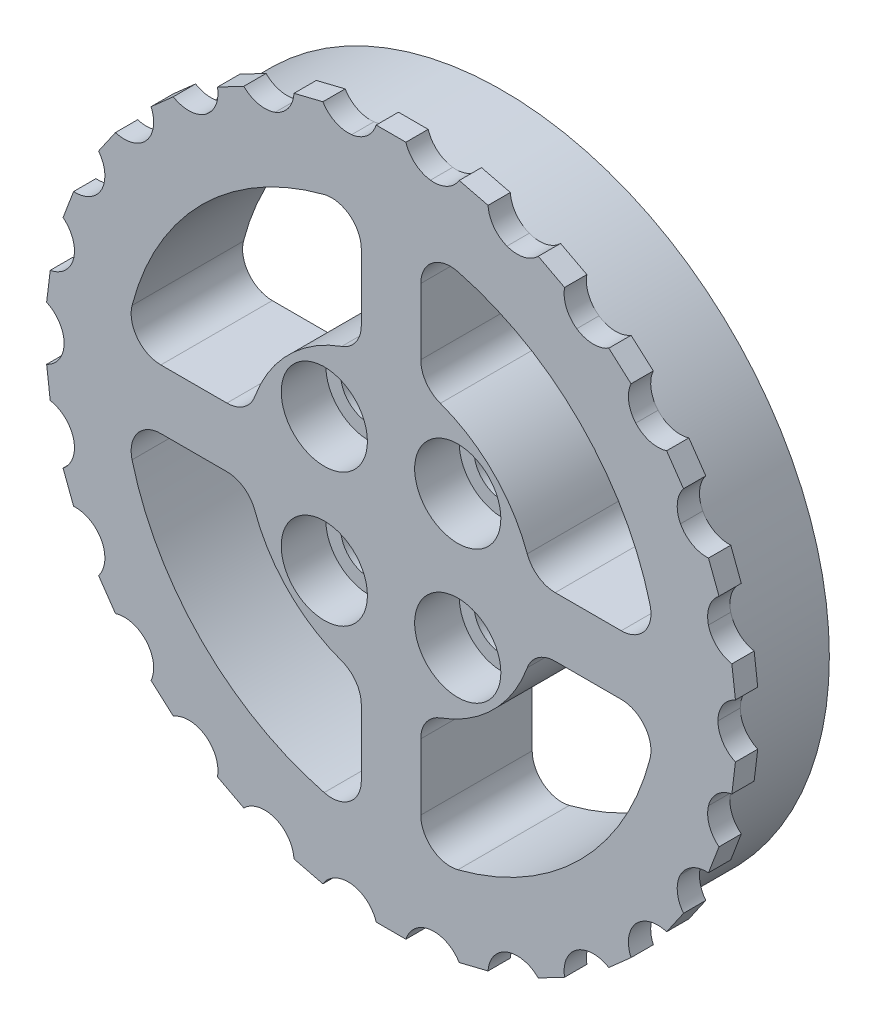
from build123d import *

# Parameters (mm, degrees)
SKETCH1_R           = 22
BOSS_EXTRUDE1_DEPTH = 6
BOSS_EXTRUDE2_DEPTH = 1.5
SKETCH3_R           = 1.375
BOSS_EXTRUDE3_DEPTH = 2.5
CUT_EXTRUDE3_REACH  = 36.304
SKETCH6_R           = 1.9
SKETCH7_R           = 2.9
CUT_EXTRUDE4_DEPTH  = 3


with BuildPart() as part:
    # Sketch1 → Boss-Extrude1 (new body)
    with BuildSketch(Plane.XY):
        Circle(SKETCH1_R)
        with BuildLine():
            Line((11.048189897, 2), (15.491933385, 2))
            ThreePointArc((15.491933385, 2), (17.073072215, 2.775255129), (17.428425058, 4.5))
            ThreePointArc((17.428425058, 4.5), (12.727922061, 12.727922061), (4.5, 17.428425058))
            ThreePointArc((4.5, 17.428425058), (2.775255129, 17.073072215), (2, 15.491933385))
            Line((2, 15.491933385), (2, 11.048189897))
            ThreePointArc((2, 11.048189897), (2.362669531, 9.899647805), (3.319148936, 9.167646936))
            ThreePointArc((3.319148936, 9.167646936), (6.894291117, 6.894291117), (9.167646936, 3.319148936))
            ThreePointArc((9.167646936, 3.319148936), (9.899647805, 2.362669531), (11.048189897, 2))
        make_face(mode=Mode.SUBTRACT)
        with BuildLine():
            Line((-15.491933385, 2), (-11.048189897, 2))
            ThreePointArc((-11.048189897, 2), (-9.899647805, 2.362669531), (-9.167646936, 3.319148936))
            ThreePointArc((-9.167646936, 3.319148936), (-6.894291117, 6.894291117), (-3.319148936, 9.167646936))
            ThreePointArc((-3.319148936, 9.167646936), (-2.362669531, 9.899647805), (-2, 11.048189897))
            Line((-2, 11.048189897), (-2, 15.491933385))
            ThreePointArc((-2, 15.491933385), (-2.775255129, 17.073072215), (-4.5, 17.428425058))
            ThreePointArc((-4.5, 17.428425058), (-12.727922061, 12.727922061), (-17.428425058, 4.5))
            ThreePointArc((-17.428425058, 4.5), (-17.073072215, 2.775255129), (-15.491933385, 2))
        make_face(mode=Mode.SUBTRACT)
        with BuildLine():
            Line((2, -11.048189897), (2, -15.491933385))
            ThreePointArc((2, -15.491933385), (2.775255129, -17.073072215), (4.5, -17.428425058))
            ThreePointArc((4.5, -17.428425058), (12.727922061, -12.727922061), (17.428425058, -4.5))
            ThreePointArc((17.428425058, -4.5), (17.073072215, -2.775255129), (15.491933385, -2))
            Line((15.491933385, -2), (11.048189897, -2))
            ThreePointArc((11.048189897, -2), (9.899647805, -2.362669531), (9.167646936, -3.319148936))
            ThreePointArc((9.167646936, -3.319148936), (6.894291117, -6.894291117), (3.319148936, -9.167646936))
            ThreePointArc((3.319148936, -9.167646936), (2.362669531, -9.899647805), (2, -11.048189897))
        make_face(mode=Mode.SUBTRACT)
        with BuildLine():
            Line((-15.491933385, -2), (-11.048189897, -2))
            ThreePointArc((-11.048189897, -2), (-9.899647805, -2.362669531), (-9.167646936, -3.319148936))
            ThreePointArc((-9.167646936, -3.319148936), (-6.894291117, -6.894291117), (-3.319148936, -9.167646936))
            ThreePointArc((-3.319148936, -9.167646936), (-2.362669531, -9.899647805), (-2, -11.048189897))
            Line((-2, -11.048189897), (-2, -15.491933385))
            ThreePointArc((-2, -15.491933385), (-2.775255129, -17.073072215), (-4.5, -17.428425058))
            ThreePointArc((-4.5, -17.428425058), (-12.727922061, -12.727922061), (-17.428425058, -4.5))
            ThreePointArc((-17.428425058, -4.5), (-17.073072215, -2.775255129), (-15.491933385, -2))
        make_face(mode=Mode.SUBTRACT)
    extrude(amount=BOSS_EXTRUDE1_DEPTH)

    # Sketch2 → Boss-Extrude2 (add)
    with BuildSketch(Plane.XY.offset(6)):
        with BuildLine():
            Line((-4.587705573, 22.79163465), (-6.529589207, 22.313003321))
            ThreePointArc((-6.529589207, 22.313003321), (-6.910364179, 21.255540917), (-7.801329494, 20.570415293))
            ThreePointArc((-7.801329494, 20.570415293), (-8.922548934, 20.492419898), (-9.908790373, 21.031441363))
            Line((-9.908790373, 21.031441363), (-11.679702424, 20.101995018))
            ThreePointArc((-11.679702424, 20.101995018), (-11.796345449, 18.984135135), (-12.497459637, 18.105696059))
            ThreePointArc((-12.497459637, 18.105696059), (-13.567432959, 17.761641694), (-14.654012294, 18.048977149))
            Line((-14.654012294, 18.048977149), (-16.15103379, 16.722731833))
            ThreePointArc((-16.15103379, 16.722731833), (-15.996766, 15.609440423), (-16.467282853, 14.588739582))
            ThreePointArc((-16.467282853, 14.588739582), (-17.423827096, 13.998621436), (-18.547596285, 14.017571989))
            Line((-18.547596285, 14.017571989), (-19.683725779, 12.371604258))
            ThreePointArc((-19.683725779, 12.371604258), (-19.267512657, 11.327581771), (-19.480087446, 10.223938589))
            ThreePointArc((-19.480087446, 10.223938589), (-20.267611735, 9.422052183), (-21.363261398, 9.171516497))
            Line((-21.363261398, 9.171516497), (-22.072471173, 7.301484012))
            ThreePointArc((-22.072471173, 7.301484012), (-21.418501513, 6.387405241), (-21.360780164, 5.264959447))
            ThreePointArc((-21.360780164, 5.264959447), (-21.93351645, 4.297907504), (-22.937371411, 3.792445804))
            Line((-22.937371411, 3.792445804), (-23.178444772, 1.807028055))
            ThreePointArc((-23.178444772, 1.807028055), (-22.324724914, 1.076015936), (-22.000061981, 0))
            ThreePointArc((-22.000061981, 0), (-22.324724914, -1.076015936), (-23.178444772, -1.807028055))
            Line((-23.178444772, -1.807028055), (-22.937371411, -3.792445804))
            ThreePointArc((-22.937371411, -3.792445804), (-21.93351645, -4.297907504), (-21.360780164, -5.264959447))
            ThreePointArc((-21.360780164, -5.264959447), (-21.418501513, -6.387405241), (-22.072471173, -7.301484012))
            Line((-22.072471173, -7.301484012), (-21.363261398, -9.171516497))
            ThreePointArc((-21.363261398, -9.171516497), (-20.267611735, -9.422052183), (-19.480087446, -10.223938589))
            ThreePointArc((-19.480087446, -10.223938589), (-19.267512657, -11.327581771), (-19.683725779, -12.371604258))
            Line((-19.683725779, -12.371604258), (-18.547596285, -14.017571989))
            ThreePointArc((-18.547596285, -14.017571989), (-17.423827096, -13.998621436), (-16.467282853, -14.588739582))
            ThreePointArc((-16.467282853, -14.588739582), (-15.996766, -15.609440423), (-16.15103379, -16.722731833))
            Line((-16.15103379, -16.722731833), (-14.654012294, -18.048977149))
            ThreePointArc((-14.654012294, -18.048977149), (-13.567432959, -17.761641694), (-12.497459637, -18.105696059))
            ThreePointArc((-12.497459637, -18.105696059), (-11.796345449, -18.984135135), (-11.679702424, -20.101995018))
            Line((-11.679702424, -20.101995018), (-9.908790373, -21.031441363))
            ThreePointArc((-9.908790373, -21.031441363), (-8.922548934, -20.492419898), (-7.801329494, -20.570415293))
            ThreePointArc((-7.801329494, -20.570415293), (-6.910364179, -21.255540917), (-6.529589207, -22.313003321))
            Line((-6.529589207, -22.313003321), (-4.587705573, -22.79163465))
            ThreePointArc((-4.587705573, -22.79163465), (-3.759118797, -22.032253145), (-2.651814437, -21.839656759))
            ThreePointArc((-2.651814437, -21.839656759), (-1.62277766, -22.291651923), (-1, -23.227260976))
            Line((-1, -23.227260976), (1, -23.227260976))
            ThreePointArc((1, -23.227260976), (1.62277766, -22.291651923), (2.651814437, -21.839656759))
            ThreePointArc((2.651814437, -21.839656759), (3.759118797, -22.032253145), (4.587705573, -22.79163465))
            Line((4.587705573, -22.79163465), (6.529589207, -22.313003321))
            ThreePointArc((6.529589207, -22.313003321), (6.910364179, -21.255540917), (7.801329494, -20.570415293))
            ThreePointArc((7.801329494, -20.570415293), (8.922548934, -20.492419898), (9.908790373, -21.031441363))
            Line((9.908790373, -21.031441363), (11.679702424, -20.101995018))
            ThreePointArc((11.679702424, -20.101995018), (11.796345449, -18.984135135), (12.497459637, -18.105696059))
            ThreePointArc((12.497459637, -18.105696059), (13.567432959, -17.761641694), (14.654012294, -18.048977149))
            Line((14.654012294, -18.048977149), (16.15103379, -16.722731833))
            ThreePointArc((16.15103379, -16.722731833), (15.996766, -15.609440423), (16.467282853, -14.588739582))
            ThreePointArc((16.467282853, -14.588739582), (17.423827096, -13.998621436), (18.547596285, -14.017571989))
            Line((18.547596285, -14.017571989), (19.683725779, -12.371604258))
            ThreePointArc((19.683725779, -12.371604258), (19.267512657, -11.327581771), (19.480087446, -10.223938589))
            ThreePointArc((19.480087446, -10.223938589), (20.267611735, -9.422052183), (21.363261398, -9.171516497))
            Line((21.363261398, -9.171516497), (22.072471173, -7.301484012))
            ThreePointArc((22.072471173, -7.301484012), (21.418501513, -6.387405241), (21.360780164, -5.264959447))
            ThreePointArc((21.360780164, -5.264959447), (21.93351645, -4.297907504), (22.937371411, -3.792445804))
            Line((22.937371411, -3.792445804), (23.178444772, -1.807028055))
            ThreePointArc((23.178444772, -1.807028055), (22.324724914, -1.076015936), (22.000061981, 0))
            ThreePointArc((22.000061981, 0), (22.324724914, 1.076015936), (23.178444772, 1.807028055))
            Line((23.178444772, 1.807028055), (22.937371411, 3.792445804))
            ThreePointArc((22.937371411, 3.792445804), (21.93351645, 4.297907504), (21.360780164, 5.264959447))
            ThreePointArc((21.360780164, 5.264959447), (21.418501513, 6.387405241), (22.072471173, 7.301484012))
            Line((22.072471173, 7.301484012), (21.363261398, 9.171516497))
            ThreePointArc((21.363261398, 9.171516497), (20.267611735, 9.422052183), (19.480087446, 10.223938589))
            ThreePointArc((19.480087446, 10.223938589), (19.267512657, 11.327581771), (19.683725779, 12.371604258))
            Line((19.683725779, 12.371604258), (18.547596285, 14.017571989))
            ThreePointArc((18.547596285, 14.017571989), (17.423827096, 13.998621436), (16.467282853, 14.588739582))
            ThreePointArc((16.467282853, 14.588739582), (15.996766, 15.609440423), (16.15103379, 16.722731833))
            Line((16.15103379, 16.722731833), (14.654012294, 18.048977149))
            ThreePointArc((14.654012294, 18.048977149), (13.567432959, 17.761641694), (12.497459637, 18.105696059))
            ThreePointArc((12.497459637, 18.105696059), (11.796345449, 18.984135135), (11.679702424, 20.101995018))
            Line((11.679702424, 20.101995018), (9.908790373, 21.031441363))
            ThreePointArc((9.908790373, 21.031441363), (8.922548934, 20.492419898), (7.801329494, 20.570415293))
            ThreePointArc((7.801329494, 20.570415293), (6.910364179, 21.255540917), (6.529589207, 22.313003321))
            Line((6.529589207, 22.313003321), (4.587705573, 22.79163465))
            ThreePointArc((4.587705573, 22.79163465), (3.759118797, 22.032253145), (2.651814437, 21.839656759))
            ThreePointArc((2.651814437, 21.839656759), (1.62277766, 22.291651923), (1, 23.227260976))
            Line((1, 23.227260976), (-1, 23.227260976))
            ThreePointArc((-1, 23.227260976), (-1.62277766, 22.291651923), (-2.651814437, 21.839656759))
            ThreePointArc((-2.651814437, 21.839656759), (-3.759118797, 22.032253145), (-4.587705573, 22.79163465))
        make_face()
        with BuildLine():
            Line((-2, 11.048189897), (-2, 15.491933385))
            ThreePointArc((-2, 15.491933385), (-2.775255129, 17.073072215), (-4.5, 17.428425058))
            ThreePointArc((-4.5, 17.428425058), (-12.727922061, 12.727922061), (-17.428425058, 4.5))
            ThreePointArc((-17.428425058, 4.5), (-17.073072215, 2.775255129), (-15.491933385, 2))
            Line((-15.491933385, 2), (-11.048189897, 2))
            ThreePointArc((-11.048189897, 2), (-9.899647805, 2.362669531), (-9.167646936, 3.319148936))
            ThreePointArc((-9.167646936, 3.319148936), (-6.894291117, 6.894291117), (-3.319148936, 9.167646936))
            ThreePointArc((-3.319148936, 9.167646936), (-2.362669531, 9.899647805), (-2, 11.048189897))
        make_face(mode=Mode.SUBTRACT)
        with BuildLine():
            Line((2, 15.491933385), (2, 11.048189897))
            ThreePointArc((2, 11.048189897), (2.362669531, 9.899647805), (3.319148936, 9.167646936))
            ThreePointArc((3.319148936, 9.167646936), (6.894291117, 6.894291117), (9.167646936, 3.319148936))
            ThreePointArc((9.167646936, 3.319148936), (9.899647805, 2.362669531), (11.048189897, 2))
            Line((11.048189897, 2), (15.491933385, 2))
            ThreePointArc((15.491933385, 2), (17.073072215, 2.775255129), (17.428425058, 4.5))
            ThreePointArc((17.428425058, 4.5), (12.727922061, 12.727922061), (4.5, 17.428425058))
            ThreePointArc((4.5, 17.428425058), (2.775255129, 17.073072215), (2, 15.491933385))
        make_face(mode=Mode.SUBTRACT)
        with BuildLine():
            Line((2, -11.048189897), (2, -15.491933385))
            ThreePointArc((2, -15.491933385), (2.775255129, -17.073072215), (4.5, -17.428425058))
            ThreePointArc((4.5, -17.428425058), (12.727922061, -12.727922061), (17.428425058, -4.5))
            ThreePointArc((17.428425058, -4.5), (17.073072215, -2.775255129), (15.491933385, -2))
            Line((15.491933385, -2), (11.048189897, -2))
            ThreePointArc((11.048189897, -2), (9.899647805, -2.362669531), (9.167646936, -3.319148936))
            ThreePointArc((9.167646936, -3.319148936), (6.894291117, -6.894291117), (3.319148936, -9.167646936))
            ThreePointArc((3.319148936, -9.167646936), (2.362669531, -9.899647805), (2, -11.048189897))
        make_face(mode=Mode.SUBTRACT)
        with BuildLine():
            Line((-11.048189897, -2), (-15.491933385, -2))
            ThreePointArc((-15.491933385, -2), (-17.073072215, -2.775255129), (-17.428425058, -4.5))
            ThreePointArc((-17.428425058, -4.5), (-12.727922061, -12.727922061), (-4.5, -17.428425058))
            ThreePointArc((-4.5, -17.428425058), (-2.775255129, -17.073072215), (-2, -15.491933385))
            Line((-2, -15.491933385), (-2, -11.048189897))
            ThreePointArc((-2, -11.048189897), (-2.362669531, -9.899647805), (-3.319148936, -9.167646936))
            ThreePointArc((-3.319148936, -9.167646936), (-6.894291117, -6.894291117), (-9.167646936, -3.319148936))
            ThreePointArc((-9.167646936, -3.319148936), (-9.899647805, -2.362669531), (-11.048189897, -2))
        make_face(mode=Mode.SUBTRACT)
    extrude(amount=BOSS_EXTRUDE2_DEPTH)

    # Sketch3 → Boss-Extrude3 (add)
    with BuildSketch(Plane(origin=(0, 0, 0), x_dir=(-1, 0, 0), z_dir=(0, 0, -1))):
        with Locations((8, 0)):
            Circle(SKETCH3_R)
        with Locations((0, -8)):
            Circle(SKETCH3_R)
        with Locations((0, 8)):
            Circle(SKETCH3_R)
        with Locations((-8, 0)):
            Circle(SKETCH3_R)
    extrude(amount=BOSS_EXTRUDE3_DEPTH)

    # Sketch6 → Cut-Extrude3 (cut, up to next)
    with BuildSketch(Plane.XY.offset(7.5), mode=Mode.PRIVATE) as cut_extrude3_sk1:
        with Locations((4.490128061, 4.490128061)):
            Circle(SKETCH6_R)
    cut_extrude3_tool1 = extrude(cut_extrude3_sk1.sketch, amount=-CUT_EXTRUDE3_REACH, mode=Mode.PRIVATE) & part.part
    # Sketch6 → Cut-Extrude3 (cut, up to next)
    with BuildSketch(Plane.XY.offset(7.5), mode=Mode.PRIVATE) as cut_extrude3_sk2:
        with Locations((4.490128061, -4.490128061)):
            Circle(SKETCH6_R)
    cut_extrude3_tool2 = extrude(cut_extrude3_sk2.sketch, amount=-CUT_EXTRUDE3_REACH, mode=Mode.PRIVATE) & part.part
    # Sketch6 → Cut-Extrude3 (cut, up to next)
    with BuildSketch(Plane.XY.offset(7.5), mode=Mode.PRIVATE) as cut_extrude3_sk3:
        with Locations((-4.490128061, 4.490128061)):
            Circle(SKETCH6_R)
    cut_extrude3_tool3 = extrude(cut_extrude3_sk3.sketch, amount=-CUT_EXTRUDE3_REACH, mode=Mode.PRIVATE) & part.part
    # Sketch6 → Cut-Extrude3 (cut, up to next)
    with BuildSketch(Plane.XY.offset(7.5), mode=Mode.PRIVATE) as cut_extrude3_sk4:
        with Locations((-4.490128061, -4.490128061)):
            Circle(SKETCH6_R)
    cut_extrude3_tool4 = extrude(cut_extrude3_sk4.sketch, amount=-CUT_EXTRUDE3_REACH, mode=Mode.PRIVATE) & part.part
    add(cut_extrude3_tool1.solids().sort_by_distance((4.490128, 4.490128, 7.5))[0], mode=Mode.SUBTRACT)
    add(cut_extrude3_tool2.solids().sort_by_distance((4.490128, -4.490128, 7.5))[0], mode=Mode.SUBTRACT)
    add(cut_extrude3_tool3.solids().sort_by_distance((-4.490128, 4.490128, 7.5))[0], mode=Mode.SUBTRACT)
    add(cut_extrude3_tool4.solids().sort_by_distance((-4.490128, -4.490128, 7.5))[0], mode=Mode.SUBTRACT)

    # Sketch7 → Cut-Extrude4 (cut)
    with BuildSketch(Plane.XY.offset(7.5)):
        with Locations((-4.490128061, 4.490128061)):
            Circle(SKETCH7_R)
        with Locations((4.490128061, 4.490128061)):
            Circle(SKETCH7_R)
        with Locations((4.490128061, -4.490128061)):
            Circle(SKETCH7_R)
        with Locations((-4.490128061, -4.490128061)):
            Circle(SKETCH7_R)
    extrude(amount=-CUT_EXTRUDE4_DEPTH, mode=Mode.SUBTRACT)


solid = part.part
